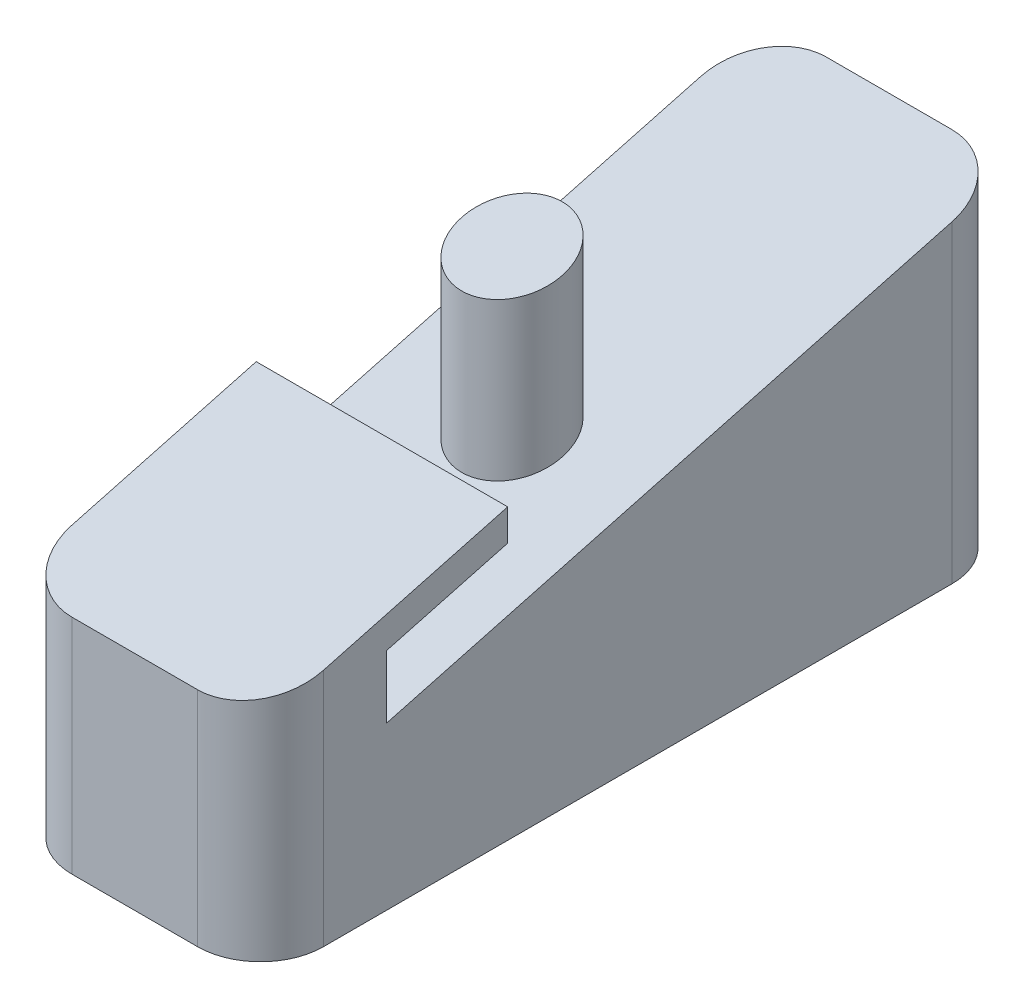
from build123d import *

# Parameters (mm, degrees)
SKETCH1_W               = 25.4
SKETCH1_H               = 76.2
BOSS_EXTRUDE1_DEPTH     = 33.3756
CUT_EXTRUDE2_DEPTH      = 57.663045059
CUT_EXTRUDE2_DEPTH_BACK = 57.663045059
BOSS_EXTRUDE2_REACH     = 63.744
SKETCH1_5_W             = 25.4
SKETCH1_5_H             = 12.7
SKETCH7_W               = 25.4
SKETCH7_H               = 3.175
BOSS_EXTRUDE3_DEPTH     = 12.7
FILLET1_R               = 6.35
BOSS_EXTRUDE4_REACH     = 70.094
SKETCH8_R               = 5.08
SKETCH8_3_R             = 5.715
CUT_EXTRUDE4_DEPTH      = 15.875


with BuildPart() as part:
    # Sketch1 → Boss-Extrude1 (new body)
    with BuildSketch(Plane(origin=(0, 0, 0), x_dir=(1, 0, 0), z_dir=(0, 1, 0))):
        Rectangle(SKETCH1_W, SKETCH1_H)
    extrude(amount=BOSS_EXTRUDE1_DEPTH)

    # Sketch4 → Cut-Extrude2 (cut, two sides: drawn at the far end of the back side and taken through both)
    with BuildSketch(Plane(origin=(12.7, 0, 0), x_dir=(0, 0, -1), z_dir=(1, 0, 0)).offset(-CUT_EXTRUDE2_DEPTH_BACK)):
        Polygon((38.1, 33.3756), (-38.1, 33.3756), (-38.1, 12.957871537), align=None)
    extrude(amount=CUT_EXTRUDE2_DEPTH + CUT_EXTRUDE2_DEPTH_BACK, mode=Mode.SUBTRACT)

    # Boss-Extrude2: from a plane face, 63.744 long prism both ways, kept between that surface and its translate by the depth
    boss_extrude2_start = Plane(origin=(-12.7, 12.957871537, 38.1), z_dir=(0, -0.9659258262890681, -0.2588190451025217)) * Box(256.976, 256.976, 128.488, align=(Align.CENTER, Align.CENTER, Align.MIN), mode=Mode.PRIVATE)
    boss_extrude2_end = Plane(origin=(-12.7, 22.482871537, 38.1), z_dir=(0, -0.9659258262890681, -0.2588190451025217)) * Box(256.976, 256.976, 128.488, align=(Align.CENTER, Align.CENTER, Align.MIN), mode=Mode.PRIVATE)
    # Sketch1<5> → Boss-Extrude2 (add, from a surface)
    with BuildSketch(Plane(origin=(0, 0, 0), x_dir=(1, 0, 0), z_dir=(0, 1, 0)), mode=Mode.PRIVATE) as boss_extrude2_sk1:
        with Locations((0, -31.75)):
            Rectangle(SKETCH1_5_W, SKETCH1_5_H)
    boss_extrude2_tool1 = extrude(boss_extrude2_sk1.sketch, amount=BOSS_EXTRUDE2_REACH, both=True, mode=Mode.PRIVATE)
    add(((boss_extrude2_tool1 - boss_extrude2_start) & boss_extrude2_end).solids().sort_by_distance((-3.175, 25.718952, -9.525))[0])

    # Sketch7 → Boss-Extrude3 (add, along a direction that is not the sketch's normal)
    with BuildSketch(Plane(origin=(0, 0, 25.4), x_dir=(-1, 0, 0), z_dir=(0, 0, -1))):
        with Locations((0, 24.298326281)):
            Rectangle(SKETCH7_W, SKETCH7_H)
    extrude(amount=BOSS_EXTRUDE3_DEPTH, dir=(0, 0.2588190451025216, -0.965925826289068))

    # Fillet1
    fillet1_edges = [part.edges().sort_by_distance(p)[0] for p in [
        (-12.7, 16.6878, -38.1),
        (-12.7, 11.241435768, 38.1),
        (12.7, 16.6878, -38.1),
        (12.7, 11.241435768, 38.1),
    ]]
    fillet(fillet1_edges, radius=FILLET1_R)

    # Boss-Extrude4: from a plane face, 70.094 long prism both ways, kept between that surface and its translate by the depth
    boss_extrude4_start = Plane(origin=(-12.7, 12.957871537, 38.1), z_dir=(0, -0.9659258262890681, -0.2588190451025217)) * Box(282.376, 282.376, 141.188, align=(Align.CENTER, Align.CENTER, Align.MIN), mode=Mode.PRIVATE)
    boss_extrude4_end = Plane(origin=(-12.7, 28.832871537, 38.1), z_dir=(0, -0.9659258262890681, -0.2588190451025217)) * Box(282.376, 282.376, 141.188, align=(Align.CENTER, Align.CENTER, Align.MIN), mode=Mode.PRIVATE)
    # Sketch8 → Boss-Extrude4 (add, from a surface)
    with BuildSketch(Plane.XZ, mode=Mode.PRIVATE) as boss_extrude4_sk1:
        Circle(SKETCH8_R)
    boss_extrude4_tool1 = extrude(boss_extrude4_sk1.sketch, amount=BOSS_EXTRUDE4_REACH, both=True, mode=Mode.PRIVATE)
    add(((boss_extrude4_tool1 - boss_extrude4_start) & boss_extrude4_end).solids().sort_by_distance((-1.058333, 28.53042, -20.017543))[0])

    # Sketch8<3> → Cut-Extrude4 (cut)
    with BuildSketch(Plane.XZ):
        Circle(SKETCH8_3_R)
    extrude(amount=-CUT_EXTRUDE4_DEPTH, mode=Mode.SUBTRACT)


solid = part.part
